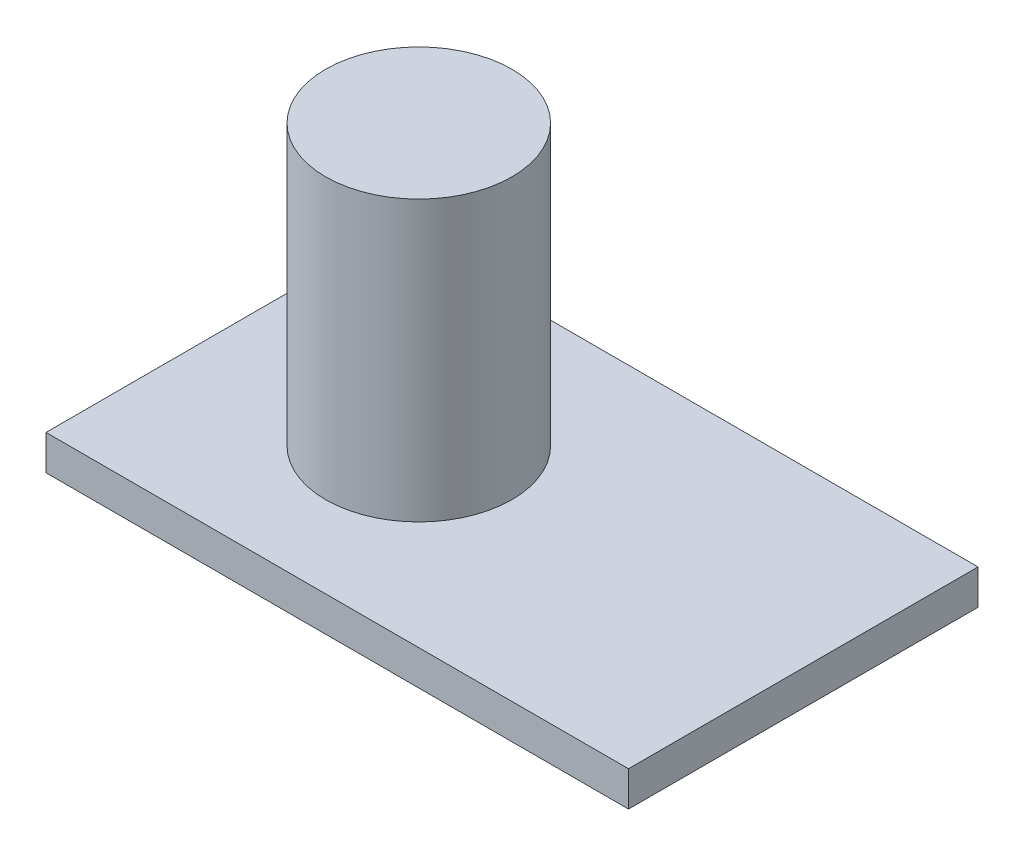
from build123d import *

# Parameters (mm, degrees)
SKETCH1_W           = 2500
SKETCH1_H           = 1500
BOSS_EXTRUDE1_DEPTH = 150
SKETCH2_R           = 400
BOSS_EXTRUDE2_DEPTH = 1200


with BuildPart() as part:
    # Sketch1 → Boss-Extrude1 (new body)
    with BuildSketch(Plane(origin=(0, 0, 0), x_dir=(1, 0, 0), z_dir=(0, 1, 0))):
        Rectangle(SKETCH1_W, SKETCH1_H)
    extrude(amount=-BOSS_EXTRUDE1_DEPTH)


with BuildPart() as body_2:
    # Sketch2 → Boss-Extrude2 (new body)
    with BuildSketch(Plane(origin=(0, 0, 0), x_dir=(1, 0, 0), z_dir=(0, 1, 0))):
        with Locations((-400, 0)):
            Circle(SKETCH2_R)
    extrude(amount=BOSS_EXTRUDE2_DEPTH)


solid = Compound([part.part, body_2.part])
